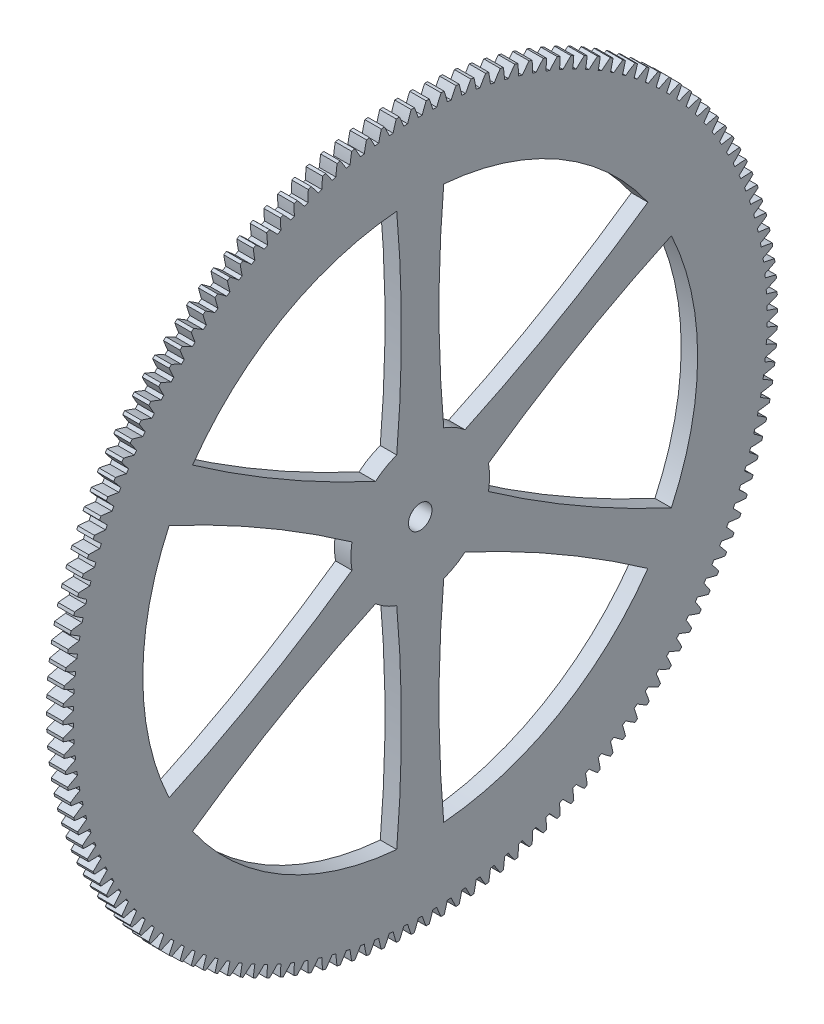
from build123d import *

# Parameters (mm, degrees)
BASPROSKE_W        = 4.445
BASPROSKE_H        = 96.52
TOOTHCUT_DEPTH     = 137.572247638
TEETHCUTS_COUNT    = 150
TEETHCUTS_ANGLE    = 357.6
BORSKE_R           = 3.175
BORE_DEPTH         = 50.8000508
CUT_EXTRUDE1_DEPTH = 137.562934294


with BuildPart() as part:
    # BasProSke → Base-Revolve (revolve)
    with BuildSketch(Plane(origin=(0, 0, 0), x_dir=(1, 0, 0), z_dir=(0, 1, 0))):
        with Locations((2.2225, 48.26)):
            Rectangle(BASPROSKE_W, BASPROSKE_H)
    revolve(axis=Axis((-10, 0, 0), (1, 0, 0)))

    # TooCutSke → ToothCut (cut, through all)
    with BuildSketch(Plane(origin=(0, 0, 0), x_dir=(0, 0, -1), z_dir=(1, 0, 0))):
        with BuildLine():
            ThreePointArc((0.525521028, 93.673725893), (0, 93.6752), (-0.525521028, 93.673725893))
            ThreePointArc((-0.525521028, 93.673725893), (-1.036907921, 95.113719083), (-1.605626664, 96.532047653))
            ThreePointArc((-1.605626664, 96.532047653), (0, 96.5454), (1.605626664, 96.532047653))
            ThreePointArc((1.605626664, 96.532047653), (1.036907921, 95.113719083), (0.525521028, 93.673725893))
        make_face()
    toothcut = extrude(amount=TOOTHCUT_DEPTH, mode=Mode.SUBTRACT)

    # TeethCuts: ToothCut ×150 about axis
    teethcuts_axis = Axis((-10, 0, 0), (1, 0, 0))
    for i in range(1, TEETHCUTS_COUNT):
        add(toothcut.rotate(teethcuts_axis, i * TEETHCUTS_ANGLE / (TEETHCUTS_COUNT - 1)), mode=Mode.SUBTRACT)

    # BorSke → Bore (cut, symmetric)
    with BuildSketch(Plane(origin=(0, 0, 0), x_dir=(0, 0, -1), z_dir=(1, 0, 0))):
        Circle(BORSKE_R)
    extrude(amount=BORE_DEPTH, both=True, mode=Mode.SUBTRACT)

    # Sketch2 → Cut-Extrude1 (cut, through all)
    with BuildSketch(Plane(origin=(4.445, 0, 0), x_dir=(0, 0, -1), z_dir=(1, 0, 0))):
        with BuildLine():
            ThreePointArc((-6.35, 17.626094967), (-5.08, 46.148369502), (-6.35, 74.670644036))
            ThreePointArc((-6.35, 74.670644036), (-37.47008, 64.900082324), (-61.491674653, 42.834583332))
            ThreePointArc((-61.491674653, 42.834583332), (-37.425660332, 27.473593802), (-12.089646011, 14.312308798))
            ThreePointArc((-12.089646011, 14.312308798), (-9.36752, 16.225020581), (-6.35, 17.626094967))
        make_face()
        with BuildLine():
            ThreePointArc((61.491674653, 42.834583332), (37.47008, 64.900082324), (6.35, 74.670644036))
            ThreePointArc((6.35, 74.670644036), (5.08, 46.148369502), (6.35, 17.626094967))
            ThreePointArc((6.35, 17.626094967), (9.36752, 16.225020581), (12.089646011, 14.312308798))
            ThreePointArc((12.089646011, 14.312308798), (37.425660332, 27.473593802), (61.491674653, 42.834583332))
        make_face()
        with BuildLine():
            ThreePointArc((-18.439646011, 3.31378617), (-42.505660332, 18.6747757), (-67.841674653, 31.836060704))
            ThreePointArc((-67.841674653, 31.836060704), (-74.94016, 0), (-67.841674653, -31.836060704))
            ThreePointArc((-67.841674653, -31.836060704), (-42.505660332, -18.6747757), (-18.439646011, -3.31378617))
            ThreePointArc((-18.439646011, -3.31378617), (-18.73504, 0), (-18.439646011, 3.31378617))
        make_face()
        with BuildLine():
            ThreePointArc((67.841674653, -31.836060704), (74.94016, 0), (67.841674653, 31.836060704))
            ThreePointArc((67.841674653, 31.836060704), (42.505660332, 18.6747757), (18.439646011, 3.31378617))
            ThreePointArc((18.439646011, 3.31378617), (18.73504, 0), (18.439646011, -3.31378617))
            ThreePointArc((18.439646011, -3.31378617), (42.505660332, -18.6747757), (67.841674653, -31.836060704))
        make_face()
        with BuildLine():
            ThreePointArc((-12.089646011, -14.312308798), (-37.425660332, -27.473593802), (-61.491674653, -42.834583332))
            ThreePointArc((-61.491674653, -42.834583332), (-37.47008, -64.900082324), (-6.35, -74.670644036))
            ThreePointArc((-6.35, -74.670644036), (-5.08, -46.148369502), (-6.35, -17.626094967))
            ThreePointArc((-6.35, -17.626094967), (-9.36752, -16.225020581), (-12.089646011, -14.312308798))
        make_face()
        with BuildLine():
            ThreePointArc((6.35, -74.670644036), (37.47008, -64.900082324), (61.491674653, -42.834583332))
            ThreePointArc((61.491674653, -42.834583332), (37.425660332, -27.473593802), (12.089646011, -14.312308798))
            ThreePointArc((12.089646011, -14.312308798), (9.36752, -16.225020581), (6.35, -17.626094967))
            ThreePointArc((6.35, -17.626094967), (5.08, -46.148369502), (6.35, -74.670644036))
        make_face()
    extrude(amount=-CUT_EXTRUDE1_DEPTH, mode=Mode.SUBTRACT)


solid = part.part
